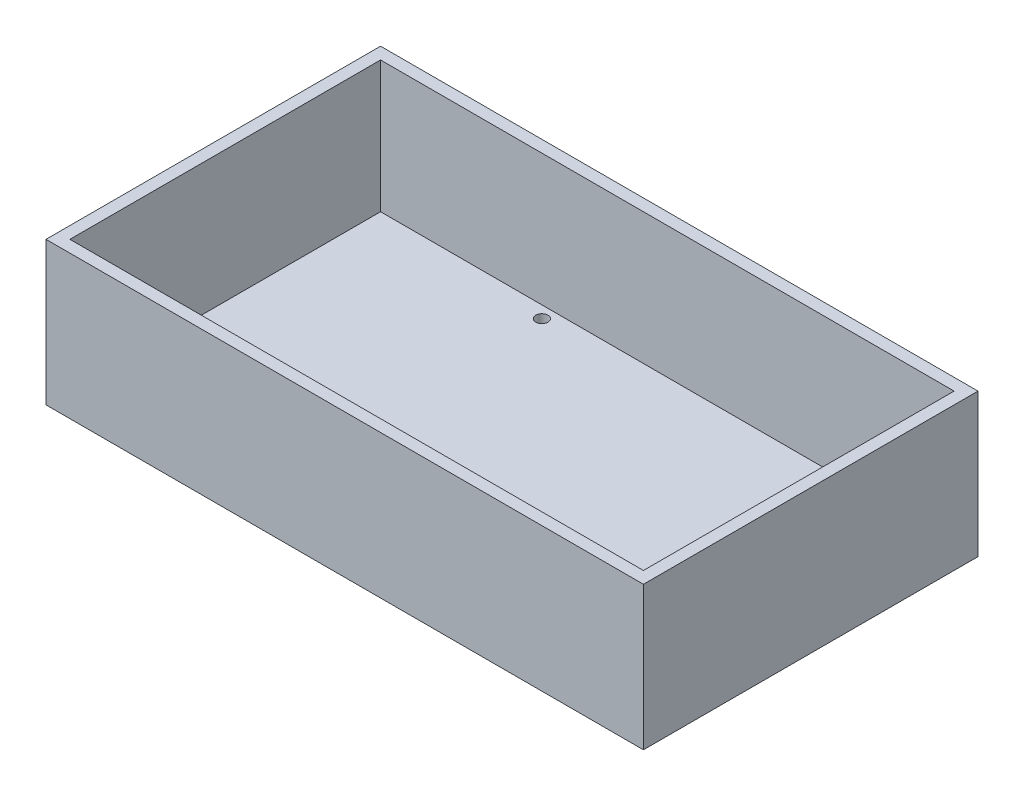
from build123d import *

# Parameters (mm, degrees)
SKETCH_1_W          = 250
SKETCH_1_H          = 140
EXTRUDE_1_DEPTH     = 60
SHELL_1_T           = -5
SKETCH_2_R          = 2.55
CUT_EXTRUDE_1_DEPTH = 154.460092532


with BuildPart() as part:
    # ｽｹｯﾁ1 → ﾎﾞｽ - 押し出し1 (new body)
    with BuildSketch(Plane(origin=(0, 0, 0), x_dir=(1, 0, 0), z_dir=(0, 1, 0))):
        Rectangle(SKETCH_1_W, SKETCH_1_H)
    extrude(amount=EXTRUDE_1_DEPTH)

    # ｼｪﾙ1
    shell_1_openings = [part.faces().sort_by_distance(p)[0] for p in [
        (0, 60, 0),
    ]]
    offset(amount=SHELL_1_T, openings=shell_1_openings, kind=Kind.INTERSECTION)

    # ｽｹｯﾁ2 → ｶｯﾄ - 押し出し1 (cut, through all)
    with BuildSketch(Plane(origin=(0, 5, 0), x_dir=(1, 0, 0), z_dir=(0, 1, 0))):
        with Locations((115, 60)):
            Circle(SKETCH_2_R)
        with Locations((115, -60)):
            Circle(SKETCH_2_R)
        with Locations((-47.5, -60)):
            Circle(SKETCH_2_R)
        with Locations((-47.5, 60)):
            Circle(SKETCH_2_R)
    extrude(amount=-CUT_EXTRUDE_1_DEPTH, mode=Mode.SUBTRACT)


solid = part.part
